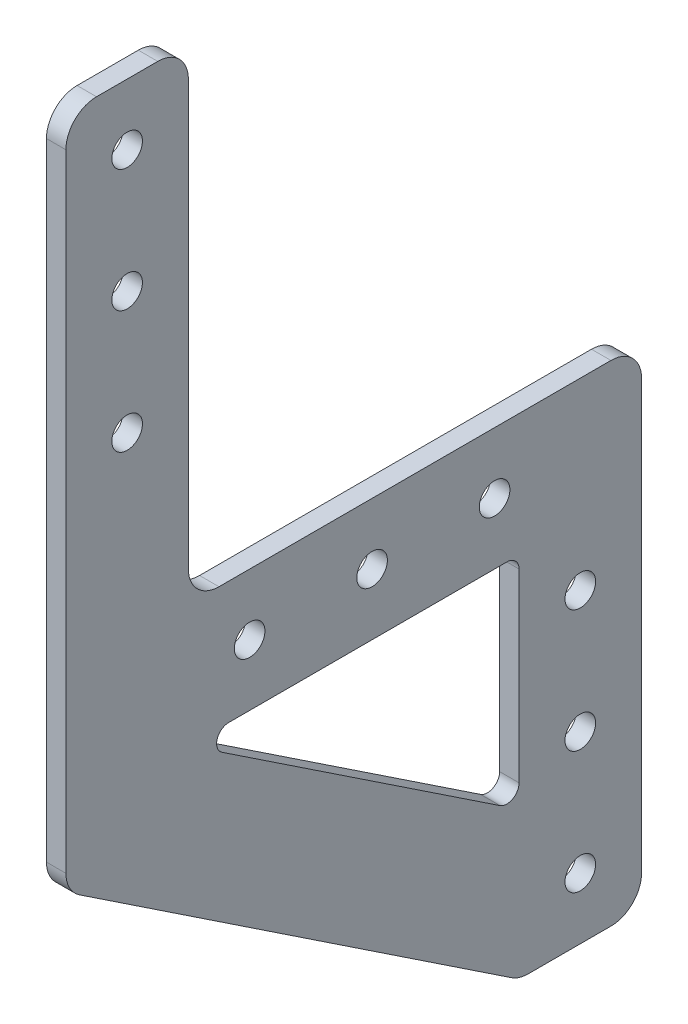
from build123d import *
from OCP.BRepFilletAPI import BRepFilletAPI_MakeFillet

# Parameters (mm, degrees)
SKETCH2_R           = 2.5
BOSS_EXTRUDE1_DEPTH = 3.175
FILLET1_R1          = 5
FILLET1_R2          = 2


with BuildPart() as part:
    # Sketch2 → Boss-Extrude1 (new body)
    with BuildSketch(Plane(origin=(0, 0, 0), x_dir=(0, 0, -1), z_dir=(1, 0, 0))):
        Polygon((-47, 89.291259303), (-27, 89.291259303), (-27, 10), (47, 10), (47, -70), (27, -70), (-47, -20.708740697), align=None)
        with Locations((-37, 79.291259303)):
            Circle(SKETCH2_R, mode=Mode.SUBTRACT)
        with Locations((-37, 59.291259303)):
            Circle(SKETCH2_R, mode=Mode.SUBTRACT)
        with Locations((-37, 39.291259303)):
            Circle(SKETCH2_R, mode=Mode.SUBTRACT)
        with Locations((37, -60)):
            Circle(SKETCH2_R, mode=Mode.SUBTRACT)
        with Locations((37, -40)):
            Circle(SKETCH2_R, mode=Mode.SUBTRACT)
        with Locations((37, -20)):
            Circle(SKETCH2_R, mode=Mode.SUBTRACT)
        with Locations((-17, 0)):
            Circle(SKETCH2_R, mode=Mode.SUBTRACT)
        with Locations((3, 0)):
            Circle(SKETCH2_R, mode=Mode.SUBTRACT)
        with Locations((23, 0)):
            Circle(SKETCH2_R, mode=Mode.SUBTRACT)
        Polygon((27, -45.96929733), (27, -10), (-27, -10), align=None, mode=Mode.SUBTRACT)
    extrude(amount=BOSS_EXTRUDE1_DEPTH)

    # Fillet1: one fillet with a radius per group of edges: ONE call of the kernel's fillet builder (fillet() takes one radius for all edges)
    fillet1_edges_1 = [part.edges().sort_by_distance(p)[0] for p in [
        (1.5875, 89.291259303, 47),
        (1.5875, 89.291259303, 27),
        (1.5875, 10, 27),
        (1.5875, 10, -47),
        (1.5875, -70, -47),
        (1.5875, -70, -27),
        (1.5875, -20.708740697, 47),
    ]]
    fillet1_edges_2 = [part.edges().sort_by_distance(p)[0] for p in [
        (1.5875, -10, -27),
        (1.5875, -10, 27),
        (1.5875, -45.96929733, -27),
    ]]
    fillet1 = BRepFilletAPI_MakeFillet(part.part.solid().wrapped)
    for e in fillet1_edges_1:
        fillet1.Add(FILLET1_R1, e.wrapped)
    for e in fillet1_edges_2:
        fillet1.Add(FILLET1_R2, e.wrapped)
    add(Compound.cast(fillet1.Shape()), mode=Mode.REPLACE)


solid = part.part
